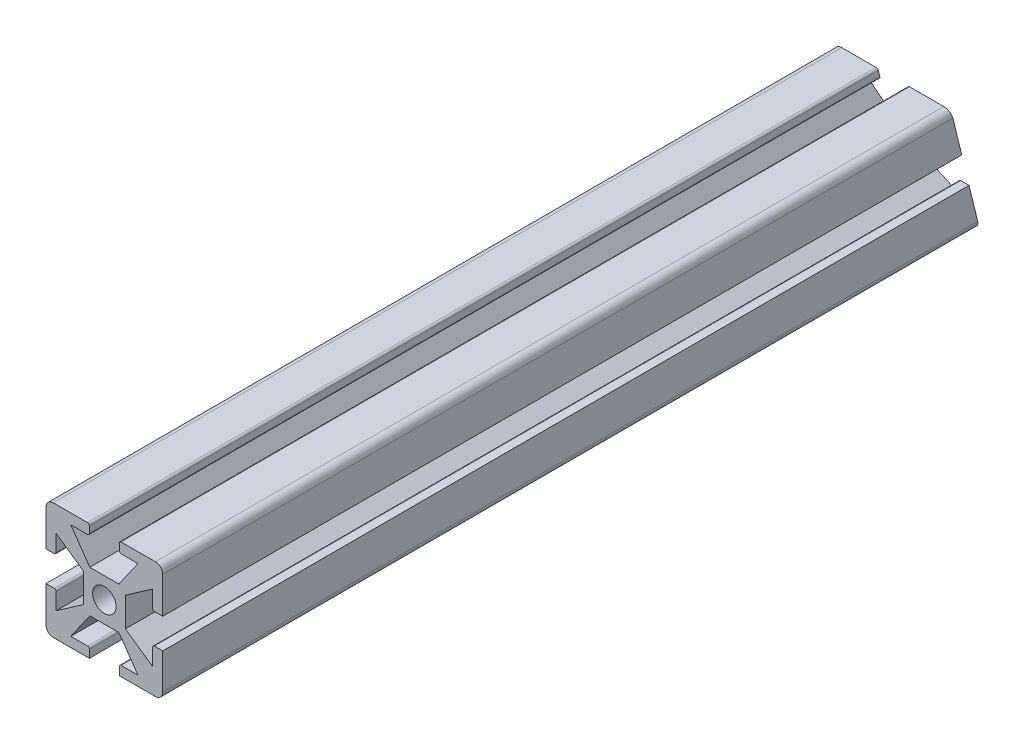
from build123d import *

# Parameters (mm, degrees)
SKETCH1_W           = 25.4
SKETCH1_H           = 25.4
BOSS_EXTRUDE1_DEPTH = 177.8
FILLET1_R           = 1.5875
HOLE1_OUTLINE_R     = 2.5527
HOLE1_DEPTH         = 177.8
SKETCH7_W           = 6.5278
SKETCH7_H           = 2.2352
CUT_EXTRUDE2_DEPTH  = 177.8
FILLET4_R           = 0.396875
CIRPATTERN2_DEPTH   = 177.8
CUT_EXTRUDE3_DEPTH  = 181.05357536


# Read off the part's stored shape, not the designer's step: Hole1, CirPattern2
with BuildPart() as part:
    # Sketch1 → Boss-Extrude1 (new body)
    with BuildSketch(Plane.XY):
        Rectangle(SKETCH1_W, SKETCH1_H)
    extrude(amount=BOSS_EXTRUDE1_DEPTH)

    # Fillet1
    fillet1_edges = [part.edges().sort_by_distance(p)[0] for p in [
        (12.7, -12.7, 88.9),
        (-12.7, -12.7, 88.9),
        (-12.7, 12.7, 88.9),
        (12.7, 12.7, 88.9),
    ]]
    fillet(fillet1_edges, radius=FILLET1_R)

    # Hole1 outline → Hole1 (cut)
    with BuildSketch(Plane.XY):
        with Locations((0, -0.048792482)):
            Circle(HOLE1_OUTLINE_R)
    extrude(amount=HOLE1_DEPTH, mode=Mode.SUBTRACT)

    # Sketch7 → Cut-Extrude2 (cut)
    with BuildSketch(Plane.XY.offset(177.8)):
        with Locations((0, 11.5824)):
            Rectangle(SKETCH7_W, SKETCH7_H)
        Polygon((-3.175, 4.5212), (-7.3025, 10.4648), (7.3025, 10.4648), (3.175, 4.5212), align=None)
    extrude(amount=-CUT_EXTRUDE2_DEPTH, mode=Mode.SUBTRACT)

    # Fillet4
    fillet4_edges = [part.edges().sort_by_distance(p)[0] for p in [
        (-3.2639, 10.4648, 88.9),
        (-3.2639, 12.7, 88.9),
        (3.2639, 12.7, 88.9),
        (3.2639, 10.4648, 88.9),
    ]]
    fillet(fillet4_edges, radius=FILLET4_R)

    # CirPattern2 outline → CirPattern2 (cut)
    with BuildSketch(Plane.XY):
        with BuildLine():
            ThreePointArc((-3.660775, -10.562384964), (-3.380141996, -10.67862696), (-3.2639, -10.959259964))
            Line((-3.2639, -10.959259964), (-3.2639, -12.7))
            Line((-3.2639, -12.7), (3.2639, -12.7))
            Line((3.2639, -12.7), (3.2639, -10.959259964))
            ThreePointArc((3.2639, -10.959259964), (3.380141996, -10.67862696), (3.660775, -10.562384964))
            Line((3.660775, -10.562384964), (7.3025, -10.562384964))
            Line((7.3025, -10.562384964), (3.175, -4.618784964))
            Line((3.175, -4.618784964), (-3.175, -4.618784964))
            Line((-3.175, -4.618784964), (-7.3025, -10.562384964))
            Line((-7.3025, -10.562384964), (-3.660775, -10.562384964))
        make_face()
        with BuildLine():
            Line((-12.7, -3.312692482), (-10.910467482, -3.312692482))
            ThreePointArc((-10.910467482, -3.312692482), (-10.629834478, -3.428934478), (-10.513592482, -3.709567482))
            Line((-10.513592482, -3.709567482), (-10.513592482, -7.351292482))
            Line((-10.513592482, -7.351292482), (-4.569992482, -3.223792482))
            Line((-4.569992482, -3.223792482), (-4.569992482, 3.126207518))
            Line((-4.569992482, 3.126207518), (-10.513592482, 7.253707518))
            Line((-10.513592482, 7.253707518), (-10.513592482, 3.611982518))
            ThreePointArc((-10.513592482, 3.611982518), (-10.629834478, 3.331349514), (-10.910467482, 3.215107518))
            Line((-10.910467482, 3.215107518), (-12.7, 3.215107518))
            Line((-12.7, 3.215107518), (-12.7, -3.312692482))
        make_face()
        with BuildLine():
            ThreePointArc((10.513592482, -3.709567482), (10.629834478, -3.428934478), (10.910467482, -3.312692482))
            Line((10.910467482, -3.312692482), (12.7, -3.312692482))
            Line((12.7, -3.312692482), (12.7, 3.215107518))
            Line((12.7, 3.215107518), (10.910467482, 3.215107518))
            ThreePointArc((10.910467482, 3.215107518), (10.629834478, 3.331349514), (10.513592482, 3.611982518))
            Line((10.513592482, 3.611982518), (10.513592482, 7.253707518))
            Line((10.513592482, 7.253707518), (4.569992482, 3.126207518))
            Line((4.569992482, 3.126207518), (4.569992482, -3.223792482))
            Line((4.569992482, -3.223792482), (10.513592482, -7.351292482))
            Line((10.513592482, -7.351292482), (10.513592482, -3.709567482))
        make_face()
    extrude(amount=CIRPATTERN2_DEPTH, mode=Mode.SUBTRACT)

    # Sketch8 → Cut-Extrude3 (cut, through all)
    with BuildSketch(Plane(origin=(12.7, 0, 0), x_dir=(0, 0, -1), z_dir=(1, 0, 0))):
        Polygon((0, 12.7), (0, -12.7), (-6.191852564, 12.7), align=None)
    extrude(amount=-CUT_EXTRUDE3_DEPTH, mode=Mode.SUBTRACT)


solid = part.part
